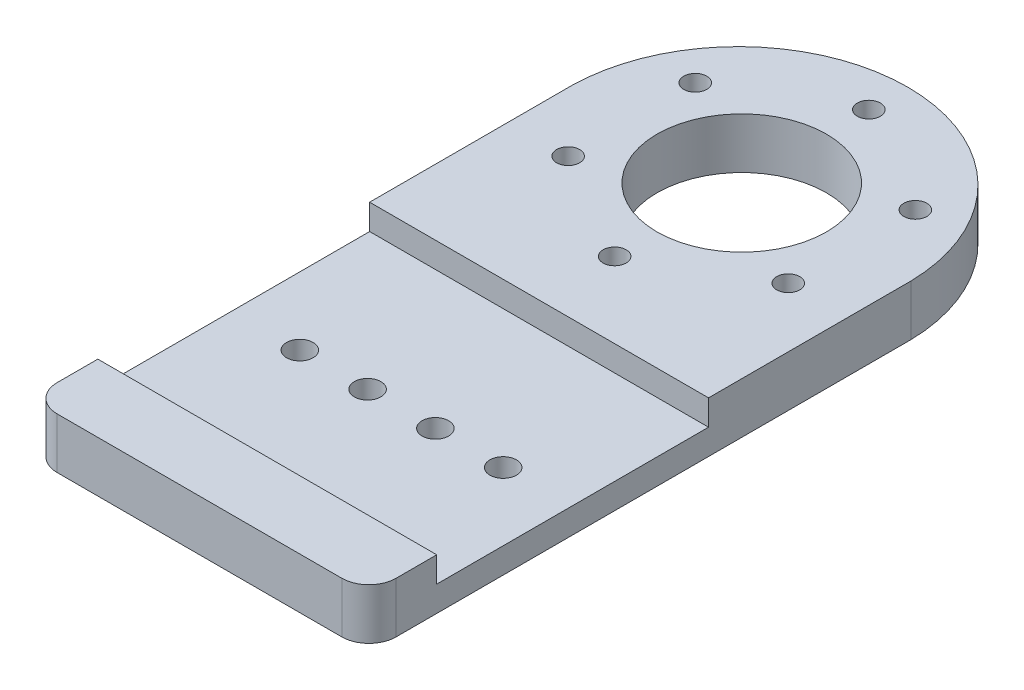
from build123d import *

# Parameters (mm, degrees)
SKETCH1_W             = 63.5
SKETCH1_H             = 12.7
BOSS_EXTRUDE2_DEPTH   = 9.525
SKETCH1_R             = 15.875
BOSS_EXTRUDE2_2_DEPTH = 9.525
SKETCH1_3_W           = 63.5
SKETCH1_3_H           = 50.927
SKETCH1_3_R           = 2.4892
BOSS_EXTRUDE3_DEPTH   = 4.7625
SKETCH2_R             = 2.159
CUT_EXTRUDE1_DEPTH    = 140.646776131
FILLET1_R             = 5.08


with BuildPart() as part:
    # Sketch1 → Boss-Extrude2 (new body)
    with BuildSketch(Plane(origin=(0, 0, 0), x_dir=(1, 0, 0), z_dir=(0, 1, 0))):
        with Locations((31.75, -117.659057971)):
            Rectangle(SKETCH1_W, SKETCH1_H)
    extrude(amount=BOSS_EXTRUDE2_DEPTH)



with BuildPart() as body_2:
    # Sketch1 → Boss-Extrude2 2 (new body)
    with BuildSketch(Plane(origin=(0, 0, 0), x_dir=(1, 0, 0), z_dir=(0, 1, 0))):
        with BuildLine():
            Line((0, -22.409057971), (0, -60.382057971))
            Line((0, -60.382057971), (63.5, -60.382057971))
            Line((63.5, -60.382057971), (63.5, -22.409057971))
            ThreePointArc((63.5, -22.409057971), (31.75, 8.708162444), (0, -22.409057971))
        make_face()
        with Locations((31.75, -22.409057971)):
            Circle(SKETCH1_R, mode=Mode.SUBTRACT)
    extrude(amount=BOSS_EXTRUDE2_2_DEPTH)


with BuildPart() as part_1:
    add(part.part)

    add(body_2.part)  # Boss-Extrude3 merges body 2
    # Sketch1<3> → Boss-Extrude3 (add)
    with BuildSketch(Plane(origin=(0, 0, 0), x_dir=(1, 0, 0), z_dir=(0, 1, 0))):
        with Locations((31.75, -85.845557971)):
            Rectangle(SKETCH1_3_W, SKETCH1_3_H)
        with Locations((12.7, -86.163057971)):
            Circle(SKETCH1_3_R, mode=Mode.SUBTRACT)
        with Locations((25.4, -86.163057971)):
            Circle(SKETCH1_3_R, mode=Mode.SUBTRACT)
        with Locations((38.1, -86.163057971)):
            Circle(SKETCH1_3_R, mode=Mode.SUBTRACT)
        with Locations((50.8, -86.163057971)):
            Circle(SKETCH1_3_R, mode=Mode.SUBTRACT)
    extrude(amount=BOSS_EXTRUDE3_DEPTH)

    # Sketch2 → Cut-Extrude1 (cut, through all)
    with BuildSketch(Plane.XZ):
        with Locations((11.127770072, 34.315307971)):
            Circle(SKETCH2_R)
        with Locations((31.75, 46.221557971)):
            Circle(SKETCH2_R)
        with Locations((52.372229928, 34.315307971)):
            Circle(SKETCH2_R)
        with Locations((52.372229928, 10.502807971)):
            Circle(SKETCH2_R)
        with Locations((31.75, -1.403442029)):
            Circle(SKETCH2_R)
        with Locations((11.127770072, 10.502807971)):
            Circle(SKETCH2_R)
    extrude(amount=-CUT_EXTRUDE1_DEPTH, mode=Mode.SUBTRACT)

    # Fillet1
    fillet1_edges = [part_1.edges().sort_by_distance(p)[0] for p in [
        (0, 4.7625, 124.009057971),
        (63.5, 4.7625, 124.009057971),
    ]]
    fillet(fillet1_edges, radius=FILLET1_R)


solid = part_1.part
